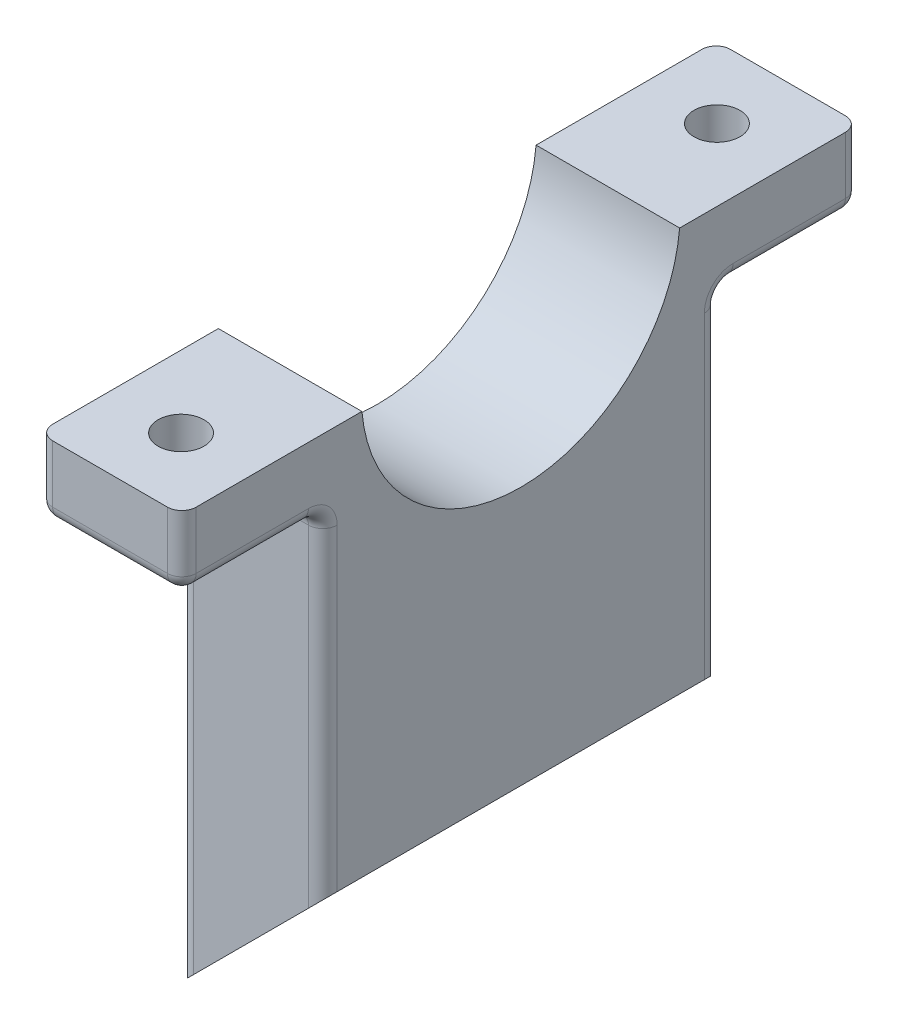
from build123d import *

# Parameters (mm, degrees)
CLAMP_EXTRUDE_DEPTH = 10
CUT_EXTRUDE3_DEPTH  = 56.03390543
FILLET2_R           = 1
FILLET3_R           = 1
CUT_EXTRUDE4_DEPTH  = 2.2
HOLE_5_R            = 1.6
CUT_EXTRUDE5_DEPTH  = 42.880637682


with BuildPart() as part:
    # Sketch4 → Clamp Extrude (new body)
    with BuildSketch(Plane(origin=(0, 0, 0), x_dir=(0, 0, -1), z_dir=(1, 0, 0))):
        with BuildLine():
            Line((-23.612500003, -1), (-23.612500003, -6))
            Line((-23.612500003, -6), (-13.789947652, -6))
            Line((-13.789947652, -6), (-13.789947652, -39.1125))
            Line((-13.789947652, -39.1125), (13.789947652, -39.1125))
            Line((13.789947652, -39.1125), (13.789947652, -6))
            Line((13.789947652, -6), (23.612500003, -6))
            Line((23.612500003, -6), (23.612500003, -1))
            Line((23.612500003, -1), (11.067414163, -1))
            ThreePointArc((11.067414163, -1), (0, -11.1125), (-11.067414163, -1))
            Line((-11.067414163, -1), (-23.612500003, -1))
        make_face()
    extrude(amount=CLAMP_EXTRUDE_DEPTH)

    # Sketch10 → Cut-Extrude3 (cut, through all)
    with BuildSketch(Plane(origin=(0, 0, -13.789947652), x_dir=(-1, 0, 0), z_dir=(0, 0, -1))):
        Polygon((0, -39.1125), (-10, -29.1125), (-10, -39.1125), align=None)
    extrude(amount=-CUT_EXTRUDE3_DEPTH, mode=Mode.SUBTRACT)

    # Fillet2
    fillet2_edges = [part.edges().sort_by_distance(p)[0] for p in [
        (0, -6, 18.701223827),
        (0, -6, -18.701223827),
        (0, -22.55625, -13.789947652),
        (0, -22.55625, 13.789947652),
        (10, -6, -18.701223827),
        (5, -6, 13.789947652),
        (5, -6, 23.612500003),
        (5, -6, -23.612500003),
        (5, -6, -13.789947652),
        (10, -17.55625, -13.789947652),
        (10, -6, 18.701223827),
        (10, -17.55625, 13.789947652),
    ]]
    fillet(fillet2_edges, radius=FILLET2_R)

    # Fillet3
    # the kernel refuses this fillet: 1 mm, written as the material it takes off along each edge
    with BuildSketch(Plane(origin=(1, -5, 22.612500003), x_dir=(-1, 0, 0), z_dir=(0, 0, 1))) as fillet3_piece_1_section:
        Polygon((0, 0), (FILLET3_R, 0), (FILLET3_R, FILLET3_R), (0, FILLET3_R), align=None)
    fillet3_piece_1 = extrude(amount=FILLET3_R, mode=Mode.PRIVATE)
    fillet3_piece_1 = fillet3_piece_1 - Plane(origin=(1, -5, 22.612500003), x_dir=(0.7071067811865475, 0.7071067811865475, 0), z_dir=(0, 0, 1)) * Sphere(FILLET3_R, mode=Mode.PRIVATE)
    add(fillet3_piece_1, mode=Mode.SUBTRACT)
    with BuildSketch(Plane(origin=(9, -5, 22.612500003), x_dir=(1, 0, 0), z_dir=(0, 0, 1))) as fillet3_piece_2_section:
        Polygon((0, 0), (FILLET3_R, 0), (FILLET3_R, -FILLET3_R), (0, -FILLET3_R), align=None)
    fillet3_piece_2 = extrude(amount=FILLET3_R, mode=Mode.PRIVATE)
    fillet3_piece_2 = fillet3_piece_2 - Plane(origin=(9, -5, 22.612500003), x_dir=(-0.7071067811865475, 0.7071067811865475, 0), z_dir=(0, 0, 1)) * Sphere(FILLET3_R, mode=Mode.PRIVATE)
    add(fillet3_piece_2, mode=Mode.SUBTRACT)
    with BuildSketch(Plane(origin=(9, -5, -22.612500003), x_dir=(0, 0, -1), z_dir=(1, 0, 0))) as fillet3_piece_3_section:
        Polygon((0, 0), (FILLET3_R, 0), (FILLET3_R, -FILLET3_R), (0, -FILLET3_R), align=None)
    fillet3_piece_3 = extrude(amount=FILLET3_R, mode=Mode.PRIVATE)
    fillet3_piece_3 = fillet3_piece_3 - Plane(origin=(9, -5, -22.612500003), x_dir=(0, 0.7071067811865475, 0.7071067811865475), z_dir=(1, 0, 0)) * Sphere(FILLET3_R, mode=Mode.PRIVATE)
    add(fillet3_piece_3, mode=Mode.SUBTRACT)
    with BuildSketch(Plane(origin=(1, -5, -22.612500003), x_dir=(0, 0, -1), z_dir=(-1, 0, 0))) as fillet3_piece_4_section:
        Polygon((0, 0), (FILLET3_R, 0), (FILLET3_R, FILLET3_R), (0, FILLET3_R), align=None)
    fillet3_piece_4 = extrude(amount=FILLET3_R, mode=Mode.PRIVATE)
    fillet3_piece_4 = fillet3_piece_4 - Plane(origin=(1, -5, -22.612500003), x_dir=(0, 0.7071067811865475, 0.7071067811865475), z_dir=(-1, 0, 0)) * Sphere(FILLET3_R, mode=Mode.PRIVATE)
    add(fillet3_piece_4, mode=Mode.SUBTRACT)
    with BuildSketch(Plane(origin=(0, 1.5, 23.612500003), x_dir=(1, 0, 0), z_dir=(0, -1, 0)), Plane(origin=(10, -5, -23.612500003), x_dir=(0, 0, 1), z_dir=(0, 1, 0))) as fillet3_piece_5:
        with BuildLine():
            CenterArc((FILLET3_R, -FILLET3_R), FILLET3_R, 90, 90)
            Line((0, -FILLET3_R), (0, 0))
            Line((0, 0), (FILLET3_R, 0))
        make_face()
    extrude(amount=6.5, mode=Mode.SUBTRACT)
    with BuildSketch(Plane(origin=(10, 1.5, 23.612500003), x_dir=(-1, 0, 0), z_dir=(0, -1, 0)), Plane(origin=(0, -5, -23.612500003), x_dir=(0, 0, 1), z_dir=(0, 1, 0))) as fillet3_piece_6:
        with BuildLine():
            CenterArc((FILLET3_R, FILLET3_R), FILLET3_R, 180, 90)
            Line((0, FILLET3_R), (0, 0))
            Line((0, 0), (FILLET3_R, 0))
        make_face()
    extrude(amount=6.5, mode=Mode.SUBTRACT)

    # Hole → Cut-Extrude4 (cut)
    with BuildSketch(Plane.XZ.offset(6)):
        Polygon((8.319764048, 18.664947652), (6.659882024, 21.539947652), (3.340117976, 21.539947652), (1.680235952, 18.664947652), (3.340117976, 15.789947652), (6.659882024, 15.789947652), align=None)
        Polygon((6.659882024, -15.789947652), (8.319764048, -18.664947652), (6.659882024, -21.539947652), (3.340117976, -21.539947652), (1.680235952, -18.664947652), (3.340117976, -15.789947652), align=None)
    extrude(amount=-CUT_EXTRUDE4_DEPTH, mode=Mode.SUBTRACT)

    # Hole<5> → Cut-Extrude5 (cut, through all)
    with BuildSketch(Plane.XZ.offset(6)):
        with Locations(Location((5, 18.664947652, 0), (0, 0, 270))):
            Circle(HOLE_5_R)
        with Locations(Location((5, -18.664947652, 0), (0, 0, 90))):
            Circle(HOLE_5_R)
    extrude(amount=-CUT_EXTRUDE5_DEPTH, mode=Mode.SUBTRACT)


solid = part.part
